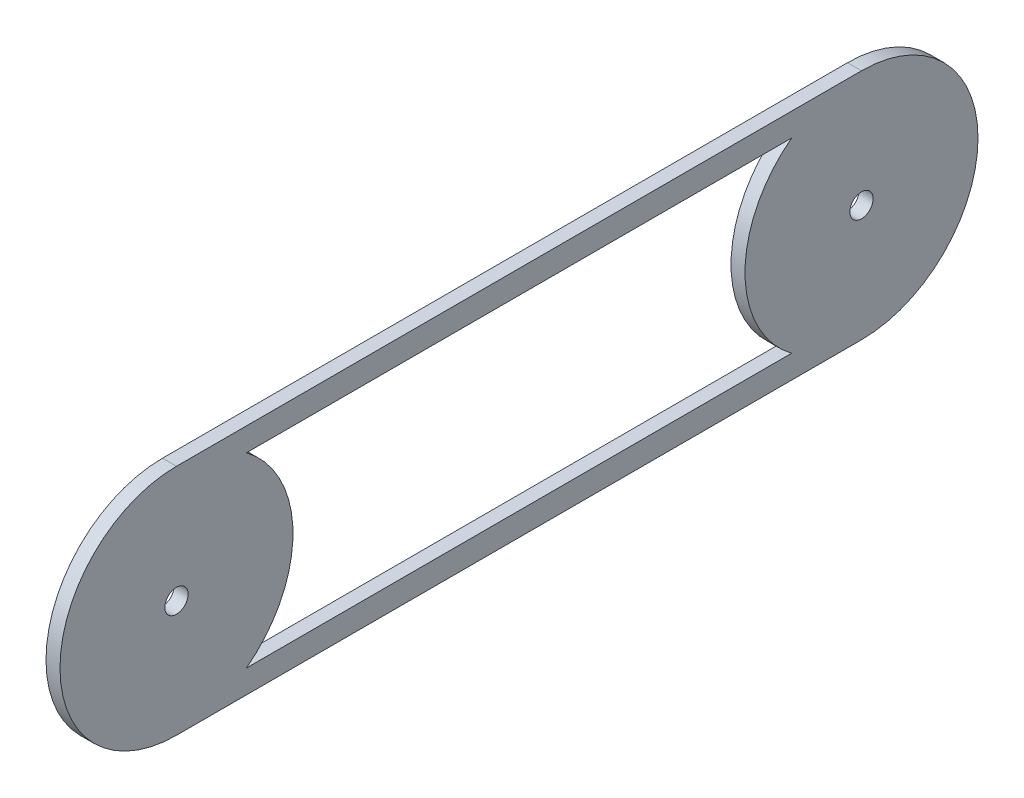
from build123d import *

# Parameters (mm, degrees)
SKETCH1_R           = 2.5
BOSS_EXTRUDE1_DEPTH = 3


with BuildPart() as part:
    # Sketch1 → Boss-Extrude1 (new body)
    with BuildSketch(Plane(origin=(0, 0, 0), x_dir=(0, 0, -1), z_dir=(1, 0, 0))):
        with BuildLine():
            Line((0, 25), (-147, 25))
            ThreePointArc((-147, 25), (-172, 0), (-147, -25))
            Line((-147, -25), (0, -25))
            ThreePointArc((0, -25), (25, 0), (0, 25))
        make_face()
        with BuildLine():
            Line((-132, 20), (-15, 20))
            ThreePointArc((-15, 20), (-25, 0), (-15, -20))
            Line((-15, -20), (-132, -20))
            ThreePointArc((-132, -20), (-122, 0), (-132, 20))
        make_face(mode=Mode.SUBTRACT)
        Circle(SKETCH1_R, mode=Mode.SUBTRACT)
        with Locations((-147, 0)):
            Circle(SKETCH1_R, mode=Mode.SUBTRACT)
    extrude(amount=BOSS_EXTRUDE1_DEPTH)


solid = part.part
